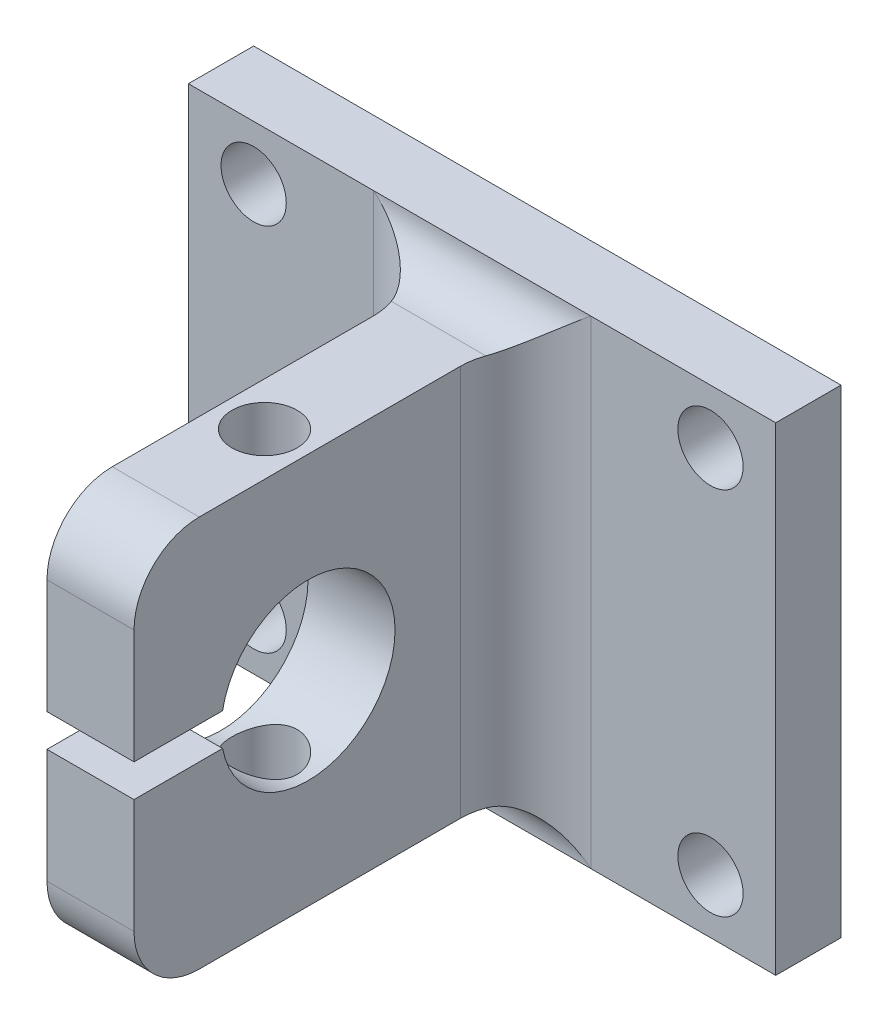
from build123d import *

# Parameters (mm, degrees)
SKETCH1_W               = 27
SKETCH1_H               = 22
SKETCH1_R               = 1.5
BOSS_EXTRUDE1_DEPTH     = 3
SKETCH2_W               = 4
SKETCH2_H               = 18
BOSS_EXTRUDE2_DEPTH     = 18
CUT_EXTRUDE1_DEPTH      = 29.324018077
CUT_EXTRUDE1_DEPTH_BACK = 29.324018077
SKETCH3_R               = 4
CUT_EXTRUDE2_DEPTH      = 29.324018077
CUT_EXTRUDE2_DEPTH_BACK = 29.324018077
SKETCH4_W               = 8.09758535
SKETCH4_H               = 1.5
FILLET1_R               = 3
CUT_EXTRUDE3_DEPTH      = 34.275366264
CUT_EXTRUDE3_DEPTH_BACK = 34.275366264
SKETCH5_R               = 1.5
FILLET2_R               = 2
FILLET3_R               = 3


with BuildPart() as part:
    # Sketch1 → Boss-Extrude1 (new body)
    with BuildSketch(Plane.XY):
        Rectangle(SKETCH1_W, SKETCH1_H)
        with Locations((-10.5, -8.5)):
            Circle(SKETCH1_R, mode=Mode.SUBTRACT)
        with Locations((-10.5, 8.5)):
            Circle(SKETCH1_R, mode=Mode.SUBTRACT)
        with Locations((10.5, 8.5)):
            Circle(SKETCH1_R, mode=Mode.SUBTRACT)
        with Locations((10.5, -8.5)):
            Circle(SKETCH1_R, mode=Mode.SUBTRACT)
    extrude(amount=BOSS_EXTRUDE1_DEPTH)

    # Sketch2 → Boss-Extrude2 (add)
    with BuildSketch(Plane.XY.offset(3)):
        Rectangle(SKETCH2_W, SKETCH2_H)
    extrude(amount=BOSS_EXTRUDE2_DEPTH)

    # Sketch3 → Cut-Extrude1 (cut, two sides: drawn at the far end of the back side and taken through both)
    with BuildSketch(Plane(origin=(2, 0, 0), x_dir=(0, 0, -1), z_dir=(1, 0, 0)).offset(-CUT_EXTRUDE1_DEPTH_BACK)):
        with Locations(Location((-13, 0, 0), (0, 0, 180))):
            Circle(SKETCH3_R)
    extrude(amount=CUT_EXTRUDE1_DEPTH + CUT_EXTRUDE1_DEPTH_BACK, mode=Mode.SUBTRACT)

    # Sketch4 → Cut-Extrude2 (cut, two sides: drawn at the far end of the back side and taken through both)
    with BuildSketch(Plane(origin=(2, 0, 0), x_dir=(0, 0, -1), z_dir=(1, 0, 0)).offset(-CUT_EXTRUDE2_DEPTH_BACK)):
        with Locations((-18.330812417, 0)):
            Rectangle(SKETCH4_W, SKETCH4_H)
    extrude(amount=CUT_EXTRUDE2_DEPTH + CUT_EXTRUDE2_DEPTH_BACK, mode=Mode.SUBTRACT)

    # Fillet1
    fillet1_edges = [part.edges().sort_by_distance(p)[0] for p in [
        (-2, 0, 3),
        (2, 0, 3),
    ]]
    fillet(fillet1_edges, radius=FILLET1_R)

    # Sketch5 → Cut-Extrude3 (cut, two sides: drawn at the far end of the back side and taken through both)
    with BuildSketch(Plane(origin=(0, 11, 0), x_dir=(1, 0, 0), z_dir=(0, 1, 0)).offset(-CUT_EXTRUDE3_DEPTH_BACK)):
        with Locations(Location((0, -13, 0), (0, 0, 270))):
            Circle(SKETCH5_R)
    extrude(amount=CUT_EXTRUDE3_DEPTH + CUT_EXTRUDE3_DEPTH_BACK, mode=Mode.SUBTRACT)

    # Fillet2
    fillet2_edges = [part.edges().sort_by_distance(p)[0] for p in [
        (0, -9, 3),
        (0, 9, 3),
    ]]
    fillet(fillet2_edges, radius=FILLET2_R - 0.0001)  # a hair under: the kernel refuses the full size

    # Fillet3
    fillet3_edges = [part.edges().sort_by_distance(p)[0] for p in [
        (0, -9, 21),
        (0, 9, 21),
    ]]
    fillet(fillet3_edges, radius=FILLET3_R)


solid = part.part
